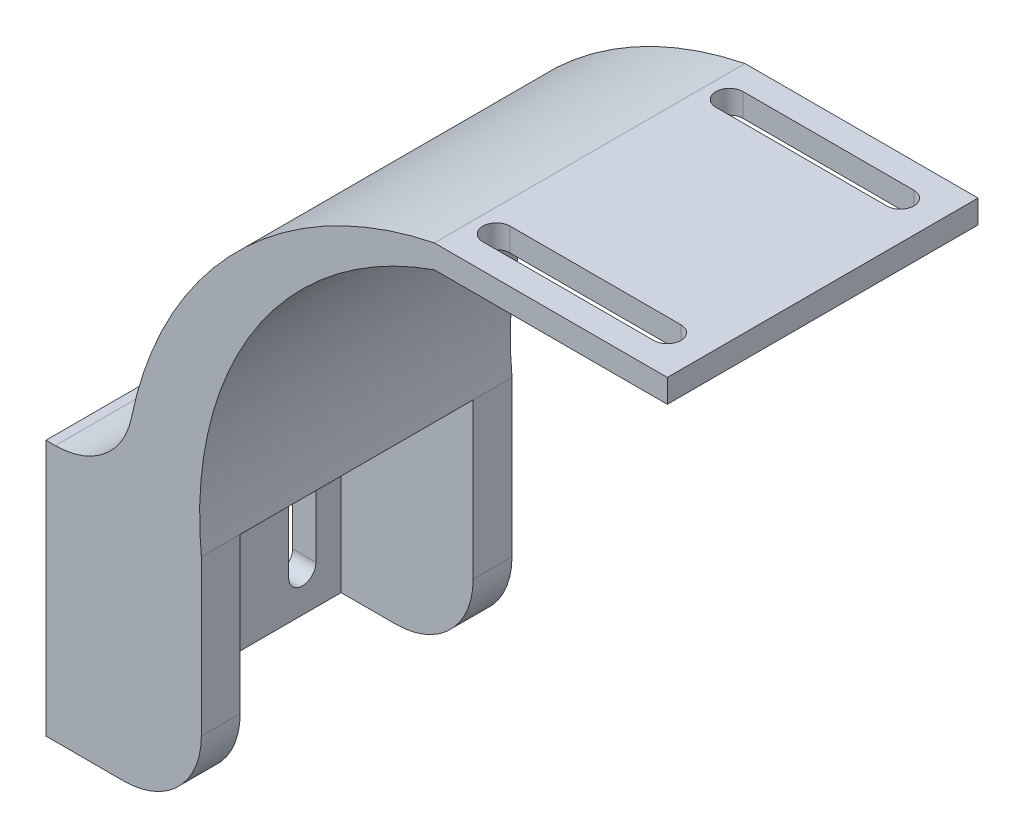
from build123d import *

# Parameters (mm, degrees)
SKETCH_1_W            = 30
SKETCH_1_H            = 30
EXTRUDE_1_DEPTH       = 3
EXTRUDE_2_DEPTH       = 30
EXTRUDE_3_DEPTH       = 40
FILLET_1_R            = 10
CUT_EXTRUDE_START     = -20
CUT_EXTRUDE_1_DEPTH   = 40
CUT_EXTRUDE_START_2   = -3
CUT_EXTRUDE_1_2_DEPTH = 3


# Read off the part's stored shape, not the designer's step: 切除-拉伸1
with BuildPart() as part:
    # 草图1 → 凸台-拉伸1 (new body)
    with BuildSketch(Plane(origin=(0, 0, 0), x_dir=(0, 0, -1), z_dir=(1, 0, 0))):
        Rectangle(SKETCH_1_W, SKETCH_1_H)
        with BuildLine():
            Line((-11.75, -10), (-11.75, 10))
            ThreePointArc((-11.75, 10), (-10, 11.75), (-8.25, 10))
            Line((-8.25, 10), (-8.25, -10))
            ThreePointArc((-8.25, -10), (-10, -11.75), (-11.75, -10))
        make_face(mode=Mode.SUBTRACT)
        with BuildLine():
            ThreePointArc((8.25, 10), (10, 11.75), (11.75, 10))
            Line((11.75, 10), (11.75, -10))
            ThreePointArc((11.75, -10), (10, -11.75), (8.25, -10))
            Line((8.25, -10), (8.25, 10))
        make_face(mode=Mode.SUBTRACT)
    extrude(amount=EXTRUDE_1_DEPTH)

    # 草图2 → 凸台-拉伸2 (add)
    with BuildSketch(Plane.XZ.offset(15)):
        Polygon((20, -20), (20, -15), (3, -15), (0, -15), (0, -20), align=None)
        Polygon((20, 20), (0, 20), (0, 15), (3, 15), (20, 15), align=None)
    extrude(amount=-EXTRUDE_2_DEPTH)

    # 草图3 → 凸台-拉伸3 (add)
    with BuildSketch(Plane.XY.offset(20)):
        with BuildLine():
            ThreePointArc((50, 65), (21.901058366, 48.400183617), (10.029526833, 18))
            Line((10.029526833, 18), (0, 18))
            Line((0, 18), (0, 15))
            Line((0, 15), (20, 15))
            ThreePointArc((20, 15), (26.843467388, 43.706297412), (50, 62))
            Line((50, 62), (80, 62))
            Line((80, 62), (80, 65))
            Line((80, 65), (50, 65))
        make_face()
    extrude(amount=-EXTRUDE_3_DEPTH)

    # 圆角1
    fillet_1_edges = [part.edges().sort_by_distance(p)[0] for p in [
        (10.029526833, 18, 0),
    ]]
    fillet(fillet_1_edges, radius=FILLET_1_R)

    # 切除-拉伸1 outline → 切除-拉伸1 (cut)
    with BuildSketch(Plane.XY.offset(CUT_EXTRUDE_START)):
        with BuildLine():
            Line((20, -15), (20, -5))
            ThreePointArc((20, -5), (17.071067812, -12.071067812), (10, -15))
            Line((10, -15), (20, -15))
        make_face()
    extrude(amount=CUT_EXTRUDE_1_DEPTH, mode=Mode.SUBTRACT)

    # Cut-Extrude 1 2 outline → Cut-Extrude 1 2 (cut)
    with BuildSketch(Plane(origin=(0, 65, 0), x_dir=(1, 0, 0), z_dir=(0, 1, 0)).offset(CUT_EXTRUDE_START_2)):
        with BuildLine():
            Line((75, 16.75), (53, 16.75))
            ThreePointArc((53, 16.75), (51.25, 15), (53, 13.25))
            Line((53, 13.25), (75, 13.25))
            ThreePointArc((75, 13.25), (76.75, 15), (75, 16.75))
        make_face()
        with BuildLine():
            Line((75, -13.25), (53, -13.25))
            ThreePointArc((53, -13.25), (51.25, -15), (53, -16.75))
            Line((53, -16.75), (75, -16.75))
            ThreePointArc((75, -16.75), (76.75, -15), (75, -13.25))
        make_face()
    extrude(amount=CUT_EXTRUDE_1_2_DEPTH, mode=Mode.SUBTRACT)


solid = part.part
